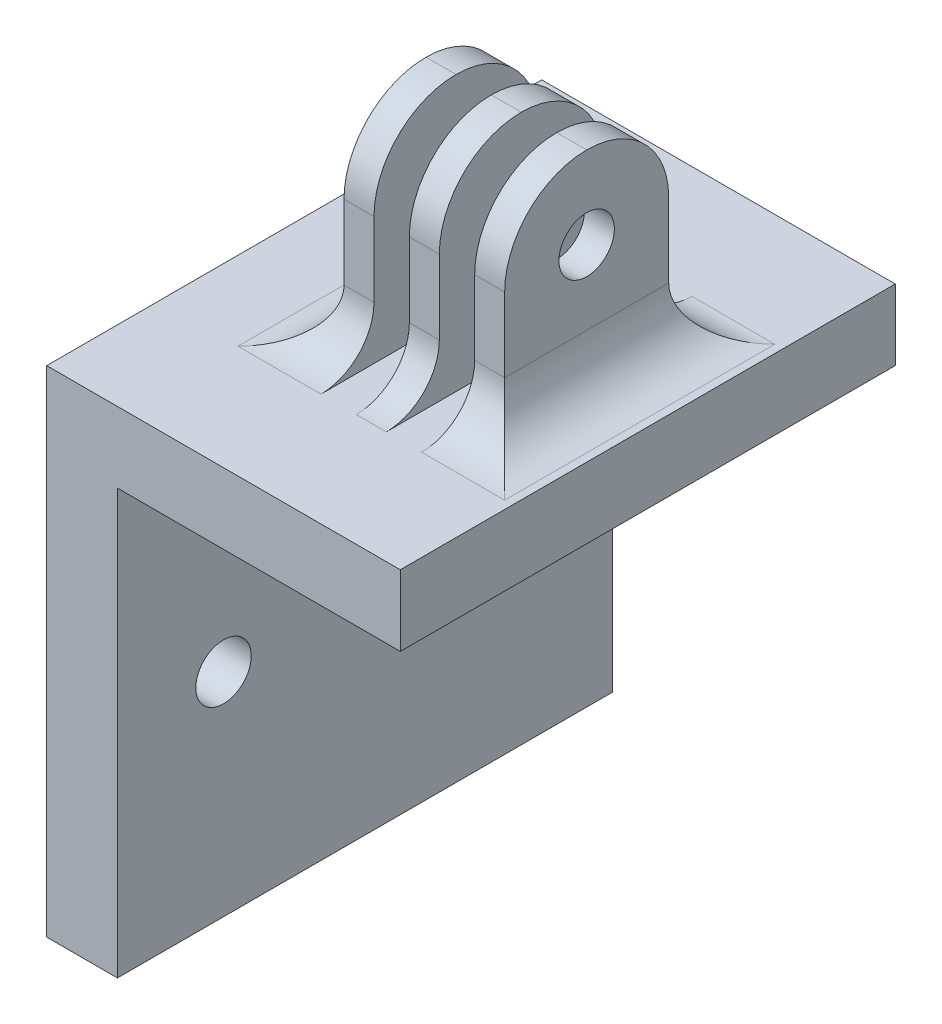
from build123d import *

# Parameters (mm, degrees)
SKETCH1_W           = 44.45
SKETCH1_H           = 44.45
SKETCH1_R           = 2.4892
BOSS_EXTRUDE1_DEPTH = 6.35
SKETCH2_W           = 44.45
SKETCH2_H           = 6.35
BOSS_EXTRUDE2_DEPTH = 25.4
SKETCH3_W           = 2.6924
SKETCH3_H           = 14.732
BOSS_EXTRUDE3_DEPTH = 18.796
FILLET3_R           = 7.366
CUT_EXTRUDE1_REACH  = 52.727
SKETCH4_R           = 2.4892
FILLET4_R           = 4.7625


with BuildPart() as part:
    # Sketch1 → Boss-Extrude1 (new body)
    with BuildSketch(Plane(origin=(0, 0, 0), x_dir=(0, 0, -1), z_dir=(1, 0, 0))):
        Rectangle(SKETCH1_W, SKETCH1_H)
        with Locations((-12.7, -3.175)):
            Circle(SKETCH1_R, mode=Mode.SUBTRACT)
        with Locations((12.7, -3.175)):
            Circle(SKETCH1_R, mode=Mode.SUBTRACT)
    extrude(amount=BOSS_EXTRUDE1_DEPTH)

    # Sketch2 → Boss-Extrude2 (add)
    with BuildSketch(Plane(origin=(6.35, 0, 0), x_dir=(0, 0, -1), z_dir=(1, 0, 0))):
        with Locations((0, 19.05)):
            Rectangle(SKETCH2_W, SKETCH2_H)
    extrude(amount=BOSS_EXTRUDE2_DEPTH)

    # Sketch3 → Boss-Extrude3 (add)
    with BuildSketch(Plane(origin=(0, 22.225, 0), x_dir=(1, 0, 0), z_dir=(0, 1, 0))):
        with Locations((13.1826, 0)):
            Rectangle(SKETCH3_W, SKETCH3_H)
        with Locations((19.05, 0)):
            Rectangle(SKETCH3_W, SKETCH3_H)
        with Locations((24.9174, 0)):
            Rectangle(SKETCH3_W, SKETCH3_H)
    extrude(amount=BOSS_EXTRUDE3_DEPTH)

    # Fillet3
    fillet3_edges = [part.edges().sort_by_distance(p)[0] for p in [
        (19.05, 41.021, -7.366),
        (13.1826, 41.021, -7.366),
        (24.9174, 41.021, 7.366),
        (19.05, 41.021, 7.366),
        (13.1826, 41.021, 7.366),
        (24.9174, 41.021, -7.366),
    ]]
    fillet(fillet3_edges, radius=FILLET3_R - 0.0001)  # a hair under: the kernel refuses the full size

    # Cut-Extrude1: up to this face of the body (flat: up to its plane)
    cut_extrude1_end = Plane(part.part.faces().sort_by_distance((26.2636, 30.911144625, 0))[0])
    # Sketch4 → Cut-Extrude1 (cut, up to the picked face)
    with BuildSketch(Plane.ZY.offset(-11.8364), mode=Mode.PRIVATE) as cut_extrude1_sk1:
        with Locations((0, 33.655)):
            Circle(SKETCH4_R)
    cut_extrude1_tool1 = split(extrude(cut_extrude1_sk1.sketch, amount=-CUT_EXTRUDE1_REACH, mode=Mode.PRIVATE), bisect_by=cut_extrude1_end, keep=Keep.BOTH, mode=Mode.PRIVATE)
    add(cut_extrude1_tool1.solids().sort_by(Axis((11.8364, 33.655, 0), (1, 0, 0)))[0], mode=Mode.SUBTRACT)

    # Fillet4
    fillet4_edges = [part.edges().sort_by_distance(p)[0] for p in [
        (13.1826, 22.225, -7.366),
        (11.8364, 22.225, 0),
        (13.1826, 22.225, 7.366),
        (19.05, 22.225, -7.366),
        (19.05, 22.225, 7.366),
        (24.9174, 22.225, -7.366),
        (24.9174, 22.225, 7.366),
        (26.2636, 22.225, 0),
    ]]
    fillet(fillet4_edges, radius=FILLET4_R)


solid = part.part
